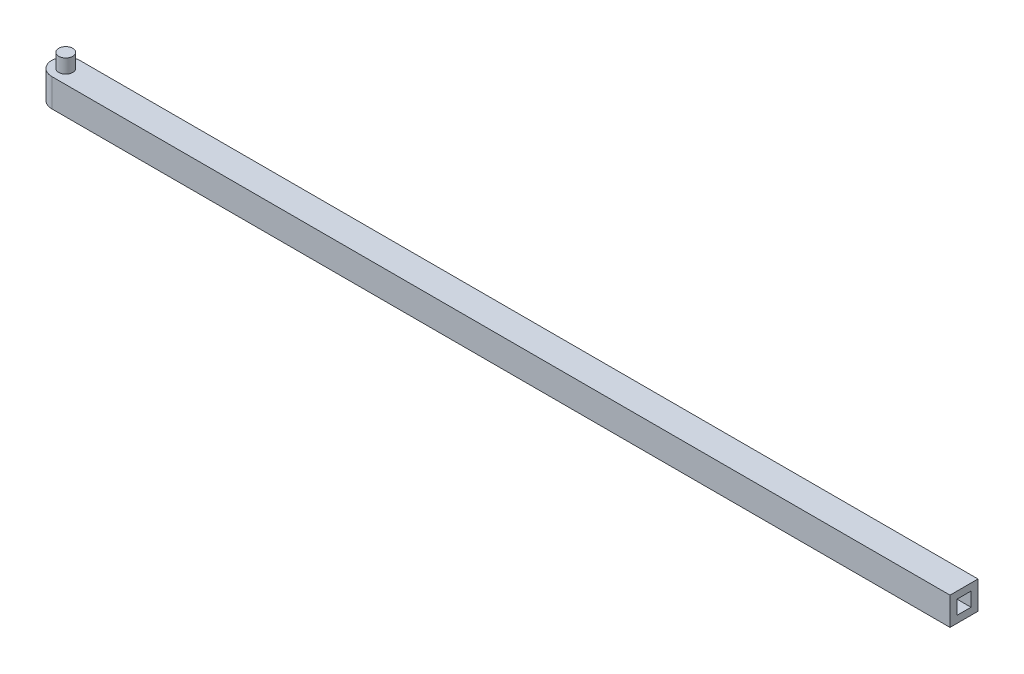
from build123d import *

# Parameters (mm, degrees)
SKETCH1_R               = 5
BOSS_EXTRUDE1_DEPTH     = 10
BOSS_EXTRUDE2_OUTLINE_R = 5
BOSS_EXTRUDE2_DEPTH     = 20
SKETCH4_W               = 10
SKETCH4_H               = 10
CUT_EXTRUDE1_DEPTH      = 10
SKETCH5_R               = 5
BOSS_EXTRUDE3_DEPTH     = 10


# Read off the part's stored shape, not the designer's step: Boss-Extrude2
with BuildPart() as part:
    # Sketch1 → Boss-Extrude1 (new body)
    with BuildSketch(Plane(origin=(0, 0, 0), x_dir=(1, 0, 0), z_dir=(0, 1, 0))):
        with Locations(Location((0, 0, 0), (0, 0, 270))):
            Circle(SKETCH1_R)
    extrude(amount=BOSS_EXTRUDE1_DEPTH)


with BuildPart() as body_2:
    # Boss-Extrude2 outline → Boss-Extrude2 (new body)
    with BuildSketch(Plane.XZ):
        with BuildLine():
            ThreePointArc((-0.004263044, 10), (-10.000000014, 0.004229813), (-0.012722666, -9.999992815))
            Line((-0.012722666, -9.999992815), (641.987277325, -10))
            Line((641.987277325, -10), (641.987277325, 10))
            Line((641.987277325, 10), (-0.004263044, 10))
        make_face()
        Circle(BOSS_EXTRUDE2_OUTLINE_R, mode=Mode.SUBTRACT)
    extrude(amount=BOSS_EXTRUDE2_DEPTH)

    # Sketch4 → Cut-Extrude1 (cut)
    with BuildSketch(Plane(origin=(641.987277325, 0, 0), x_dir=(0, 0, -1), z_dir=(1, 0, 0))):
        with Locations((0, -10)):
            Rectangle(SKETCH4_W, SKETCH4_H)
    extrude(amount=-CUT_EXTRUDE1_DEPTH, mode=Mode.SUBTRACT)

    # Sketch5 → Boss-Extrude3 (add)
    with BuildSketch(Plane.XZ.offset(20)):
        with Locations(Location((0, 0, 0), (0, 0, 270))):
            Circle(SKETCH5_R)
    extrude(amount=-BOSS_EXTRUDE3_DEPTH)


solid = Compound([part.part, body_2.part])
